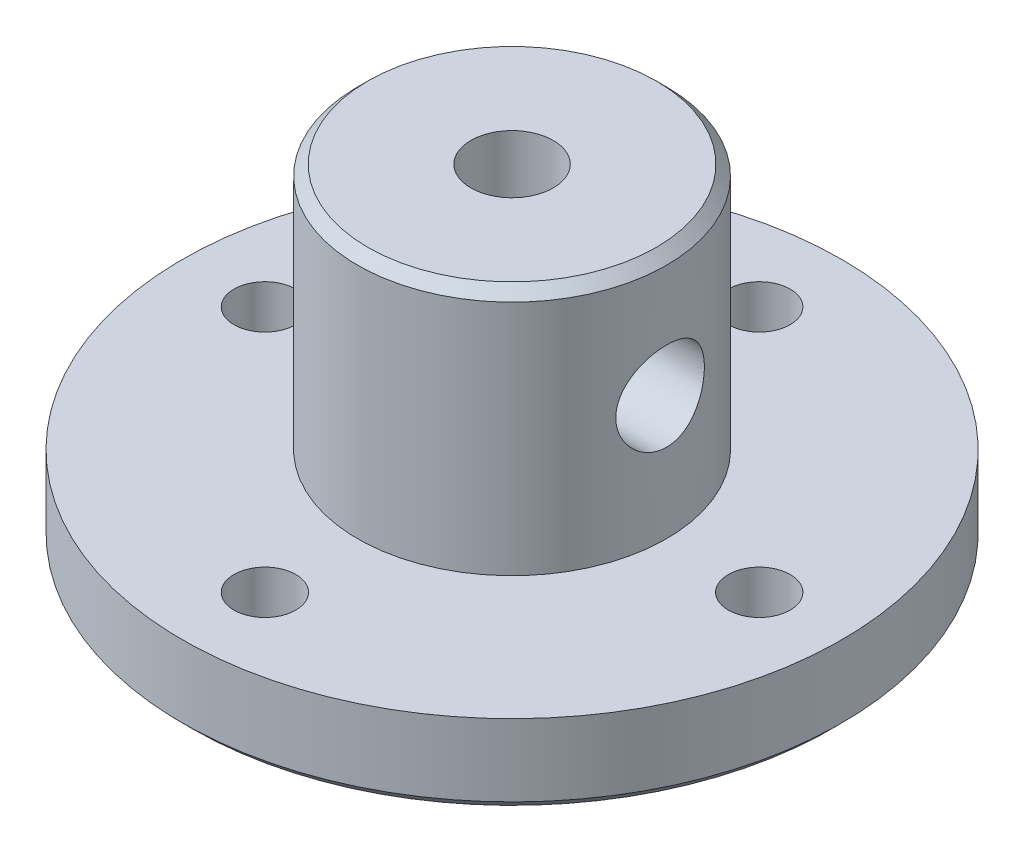
from build123d import *

# Parameters (mm, degrees)
SKETCH3_R                    = 2
CUT_EXTRUDE1_DEPTH           = 28.712812921
M4_CLEARANCE_HOLE1_OUTLINE_W = 2.15
M4_CLEARANCE_HOLE1_OUTLINE_H = 7.500042463
SKETCH13_R                   = 1.5
CUT_EXTRUDE3_DEPTH           = 26.612496997


# Read off the part's stored shape, not the designer's step: M4 Clearance Hole1
with BuildPart() as part:
    # Sketch2 → Revolve1 (revolve)
    with BuildSketch(Plane.XY, mode=Mode.PRIVATE) as revolve1_sk:
        Polygon((0, 22.228628213), (7, 22.228628213), (7.5, 21.728628213), (7.5, 10.228628213), (16, 10.228628213), (16, 6.728628213), (15.5, 6.228628213), (0, 6.228628213), align=None)
    revolve(revolve1_sk.sketch.rotate(Axis((0, 0, 0), (0, 1, 0)), 90), axis=Axis((0, 0, 0), (0, 1, 0)))

    # Sketch3 → Cut-Extrude1 (cut, through all)
    with BuildSketch(Plane(origin=(0, 22.228628213, 0), x_dir=(1, 0, 0), z_dir=(0, 1, 0))):
        with Locations(Location((0, 0, 0), (0, 0, 270))):
            Circle(SKETCH3_R)
    extrude(amount=-CUT_EXTRUDE1_DEPTH, mode=Mode.SUBTRACT)

    # M4 Clearance Hole1 outline → M4 Clearance Hole1 (revolve, cut)
    with BuildSketch(Plane(origin=(0, 16.228628213, 0), x_dir=(0, 1, 0), z_dir=(0, 0, -1))):
        with Locations((1.075, 3.750021232)):
            Rectangle(M4_CLEARANCE_HOLE1_OUTLINE_W, M4_CLEARANCE_HOLE1_OUTLINE_H)
    revolve(axis=Axis((0, 16.228628213, 0), (1, 0, 0)), mode=Mode.SUBTRACT)

    # Sketch13 → Cut-Extrude3 (cut, through all)
    with BuildSketch(Plane(origin=(0, 10.228628213, 0), x_dir=(1, 0, 0), z_dir=(0, 1, 0))):
        with Locations(Location((-12, 0, 0), (0, 0, 270))):
            Circle(SKETCH13_R)
        with Locations(Location((0, 12, 0), (0, 0, 270))):
            Circle(SKETCH13_R)
        with Locations(Location((12, 0, 0), (0, 0, 270))):
            Circle(SKETCH13_R)
        with Locations(Location((0, -12, 0), (0, 0, 270))):
            Circle(SKETCH13_R)
    extrude(amount=-CUT_EXTRUDE3_DEPTH, mode=Mode.SUBTRACT)


solid = part.part
